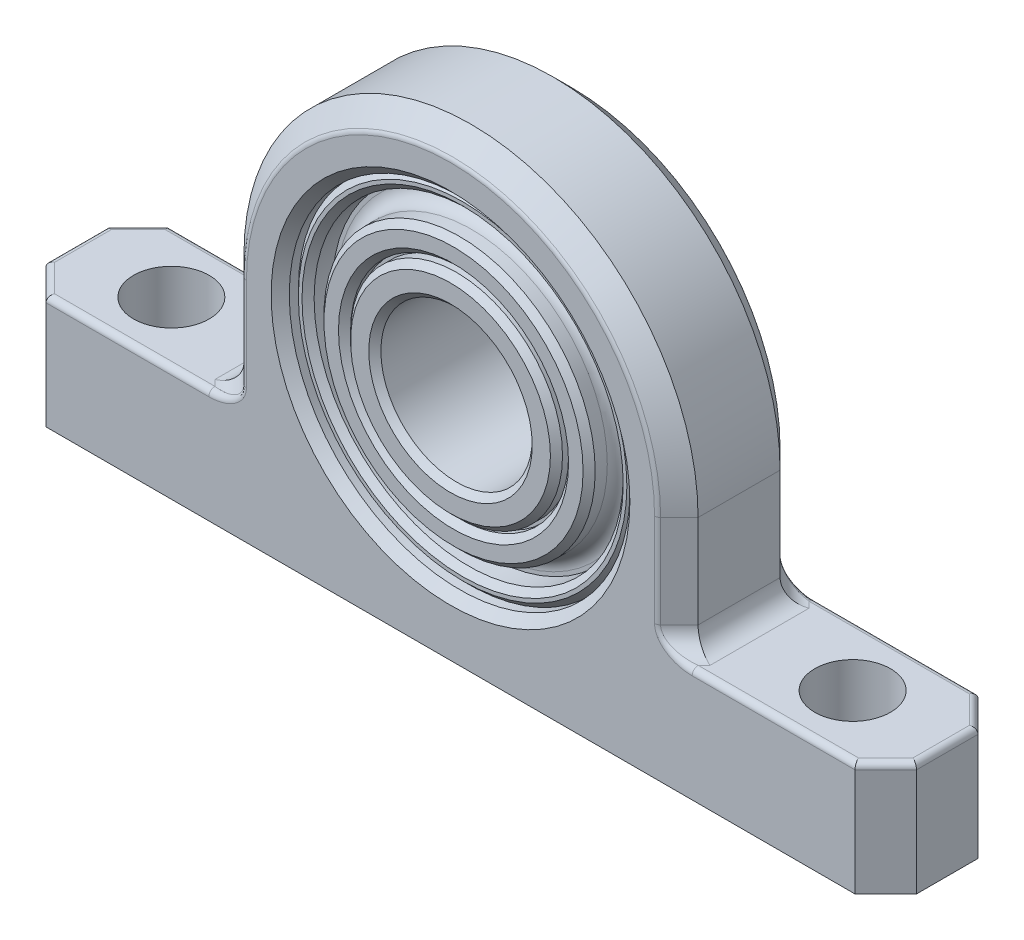
from build123d import *

# Parameters (mm, degrees)
EXTRUDE1_DEPTH      = 2.579687
EXTRUDE1_DEPTH_BACK = 2.579687
SKETCH3_R           = 7.14375
SKETCH4_R           = 1.5875
CUT_EXTRUDE1_DEPTH  = 24.325481888
CHAMFER3_SIZE       = 0.859895833
FILLET6_R           = 0.859895833
FILLET7_R           = 0.254
CHAMFER4_SIZE       = 0.381
CHAMFER5_SIZE       = 0.254
FILLET8_R           = 0.635


with BuildPart() as part:
    # Sketch3 → Extrude1 (new, two sides: drawn at the far end of the back side and taken through both)
    with BuildSketch(Plane.XY.offset(-EXTRUDE1_DEPTH_BACK)):
        with BuildLine():
            Line((9.525, 0), (9.525, -4.7625))
            Line((9.525, -4.7625), (18.25625, -4.7625))
            Line((18.25625, -4.7625), (18.25625, -9.525))
            Line((18.25625, -9.525), (-18.25625, -9.525))
            Line((-18.25625, -9.525), (-18.25625, -4.7625))
            Line((-18.25625, -4.7625), (-9.525, -4.7625))
            Line((-9.525, -4.7625), (-9.525, 0))
            ThreePointArc((-9.525, 0), (0, 9.525), (9.525, 0))
        make_face()
        Circle(SKETCH3_R, mode=Mode.SUBTRACT)
    extrude(amount=EXTRUDE1_DEPTH + EXTRUDE1_DEPTH_BACK)

    # Sketch4 → Cut-Extrude1 (cut, through all)
    with BuildSketch(Plane(origin=(0, -4.7625, 0), x_dir=(1, 0, 0), z_dir=(0, 1, 0))):
        with Locations(Location((-14.2875, 0, 0), (0, 0, 270))):
            Circle(SKETCH4_R)
        with Locations(Location((14.2875, 0, 0), (0, 0, 270))):
            Circle(SKETCH4_R)
        Polygon((-18.25625, 2.5796875), (-18.25625, 1.28984375), (-16.96640625, 2.5796875), align=None)
        Polygon((16.96640625, 2.5796875), (18.25625, 2.5796875), (18.25625, 1.28984375), align=None)
        Polygon((18.25625, -2.5796875), (18.25625, -1.28984375), (16.96640625, -2.5796875), align=None)
        Polygon((-16.96640625, -2.5796875), (-18.25625, -2.5796875), (-18.25625, -1.28984375), align=None)
    extrude(amount=-CUT_EXTRUDE1_DEPTH, mode=Mode.SUBTRACT)

    # Chamfer3
    chamfer3_edges = [part.edges().sort_by_distance(p)[0] for p in [
        (0, 9.525, -2.579687),
        (9.525, -2.38125, -2.579687),
        (9.525, -2.38125, 2.579687),
        (-9.525, -2.38125, -2.579687),
        (0, 9.525, 2.579687),
        (-9.525, -2.38125, 2.579687),
    ]]
    chamfer(chamfer3_edges, length=CHAMFER3_SIZE)

    # Fillet6
    fillet6_edges = [part.edges().sort_by_distance(p)[0] for p in [
        (9.525, -4.7625, 0),
        (-9.095052083, -4.7625, -2.149739083),
        (9.095052083, -4.7625, -2.149739083),
        (-9.095052083, -4.7625, 2.149739083),
        (9.095052083, -4.7625, 2.149739083),
        (-9.525, -4.7625, 0),
    ]]
    fillet(fillet6_edges, radius=FILLET6_R)

    # Fillet7
    fillet7_edges = [part.edges().sort_by_distance(p)[0] for p in [
        (8.665104167, -1.951302083, -2.579687),
        (0, 8.665104167, -2.579687),
        (0, 8.665104167, 2.579687),
        (-8.665104167, -1.951302083, 2.579687),
        (-13.423793633, -4.7625, 2.579687),
        (-13.423793633, -4.7625, -2.579687),
        (-8.665104167, -1.951302083, -2.579687),
        (8.665104167, -1.951302083, 2.579687),
        (-9.095535719, -4.558959231, -2.579687),
        (-9.095535719, -4.558959231, 2.579687),
        (9.095535719, -4.558959231, -2.579687),
        (9.095535719, -4.558959231, 2.579687),
        (-17.611328375, -4.7625, -1.934765375),
        (13.423793633, -4.7625, -2.579687),
        (17.611328375, -4.7625, -1.934765375),
        (18.25625, -4.7625, 0),
        (13.423793633, -4.7625, 2.579687),
        (17.611328375, -4.7625, 1.934765375),
        (-18.25625, -4.7625, 0),
        (-17.611328375, -4.7625, 1.934765375),
    ]]
    fillet(fillet7_edges, radius=FILLET7_R)

    # Chamfer4
    chamfer4_edges = [part.edges().sort_by_distance(p)[0] for p in [
        (-7.14375, 0, 2.579687),
        (-7.14375, 0, -2.579687),
    ]]
    chamfer(chamfer4_edges, length=CHAMFER4_SIZE)


with BuildPart() as body_2:
    # Sketch5 → Revolve1 (revolve)
    with BuildSketch(Plane(origin=(0, 0, 0), x_dir=(0, 0, -1), z_dir=(1, 0, 0)), mode=Mode.PRIVATE) as revolve1_sk:
        Polygon((-2.0716875, 6.482291667), (-1.0556875, 6.482291667), (-1.0556875, 5.688541667), (-2.4526875, 5.688541667), (-2.4526875, 4.572), (-1.9446875, 4.572), (-1.9446875, 4.445), (-2.5796875, 4.445), (-2.5796875, 3.175), (2.5796875, 3.175), (2.5796875, 4.445), (1.9446875, 4.445), (1.9446875, 4.572), (2.4526875, 4.572), (2.4526875, 5.688541667), (1.0556875, 5.688541667), (1.0556875, 6.482291667), (2.0716875, 6.482291667), (2.0716875, 7.14375), (-2.0716875, 7.14375), align=None)
    revolve(revolve1_sk.sketch.rotate(Axis((0, 0, -2.5796875), (0, 0, 1)), 90), axis=Axis((0, 0, -2.5796875), (0, 0, 1)))

    # Chamfer5
    chamfer5_edges = [body_2.edges().sort_by_distance(p)[0] for p in [
        (5.688541667, 0, 2.4526875),
        (4.572, 0, 2.4526875),
        (4.445, 0, 2.5796875),
        (3.175, 0, 2.5796875),
        (3.175, 0, -2.5796875),
        (4.445, 0, -2.5796875),
        (4.572, 0, -2.4526875),
        (5.688541667, 0, -2.4526875),
        (6.482291667, 0, -2.0716875),
        (7.14375, 0, -2.0716875),
        (7.14375, 0, 2.0716875),
        (6.482291667, 0, 2.0716875),
    ]]
    chamfer(chamfer5_edges, length=CHAMFER5_SIZE)

    # Fillet8
    fillet8_edges = [body_2.edges().sort_by_distance(p)[0] for p in [
        (5.688541667, 0, 1.0556875),
        (5.688541667, 0, -1.0556875),
    ]]
    fillet(fillet8_edges, radius=FILLET8_R)


solid = Compound([part.part, body_2.part])
